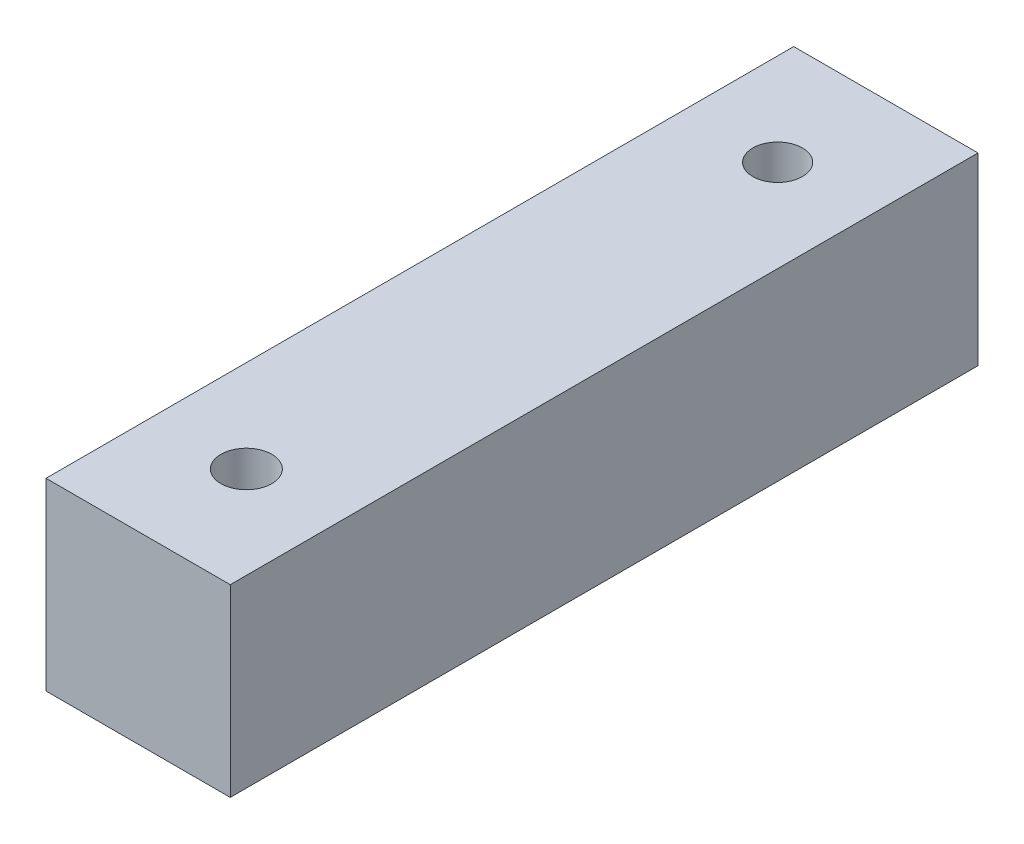
from build123d import *

# Parameters (mm, degrees)
SKETCH1_W           = 12.7
SKETCH1_H           = 12.7
BOSS_EXTRUDE1_DEPTH = 51.53914
SKETCH2_R           = 1.75452968
SKETCH2_R_2         = 1.710055228
CUT_EXTRUDE1_DEPTH  = 54.459287799


with BuildPart() as part:
    # Sketch1 → Boss-Extrude1 (new body)
    with BuildSketch(Plane.XY):
        Rectangle(SKETCH1_W, SKETCH1_H)
    extrude(amount=BOSS_EXTRUDE1_DEPTH)

    # Sketch2 → Cut-Extrude1 (cut, through all)
    with BuildSketch(Plane.XZ.offset(6.35)):
        with Locations((0, 44.07789)):
            Circle(SKETCH2_R)
        with Locations((0, 7.46125)):
            Circle(SKETCH2_R_2)
    extrude(amount=-CUT_EXTRUDE1_DEPTH, mode=Mode.SUBTRACT)


solid = part.part
